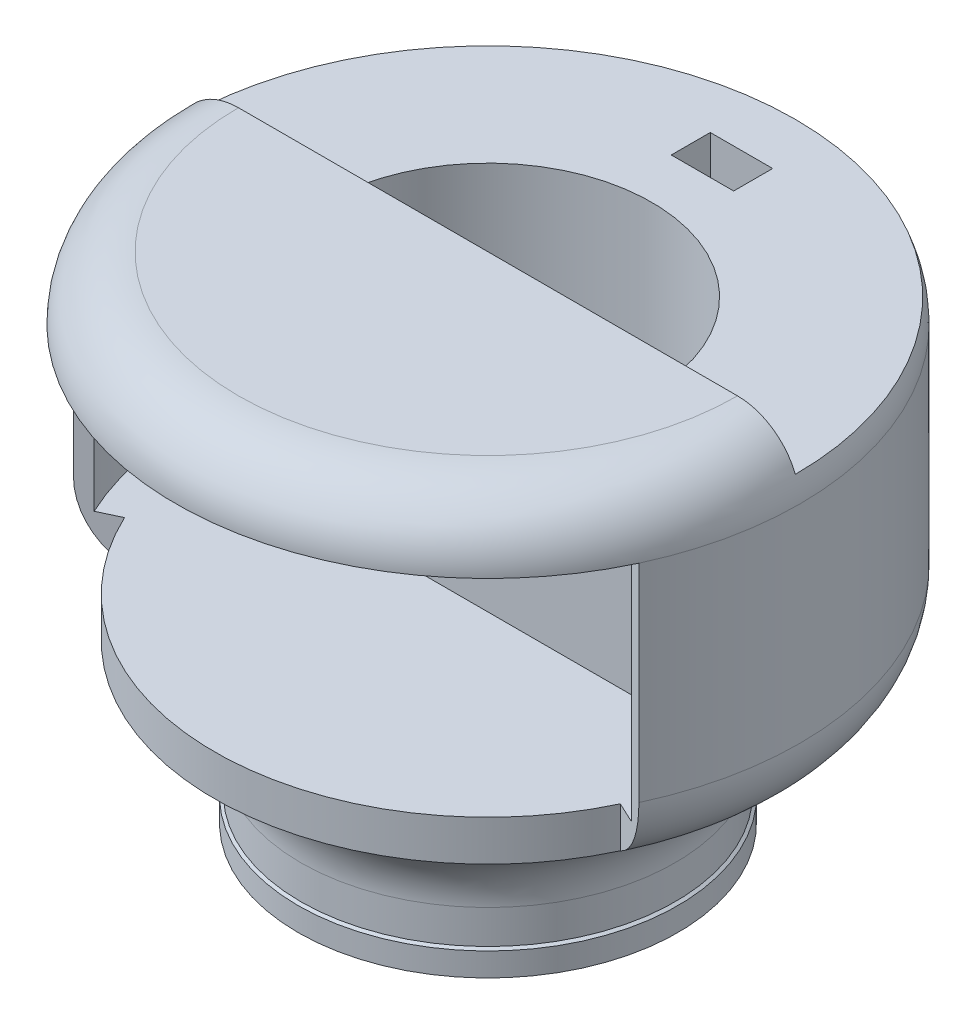
from build123d import *

# Parameters (mm, degrees)
CUT_EXTRUDE3_DEPTH           = 60
CUT_EXTRUDE5_DEPTH           = 2
CUT_EXTRUDE5_DEPTH_BACK      = 30
SKETCH9_R                    = 38
SKETCH9_R_2                  = 23
SKETCH19_W                   = 12
SKETCH19_H                   = 36.5
CUT_REVOLVE2_ANGLE           = 65
CUT_REVOLVE2_OTHER_WAY_ANGLE = 65
SKETCH21_W                   = 3.25
SKETCH21_H                   = 4
BOSS_EXTRUDE3_DEPTH          = 1.35
CIRPATTERN1_COUNT            = 5
CUT_EXTRUDE9_START           = -5
CUT_EXTRUDE9_DEPTH           = 5
SKETCH23_R                   = 10.5
CUT_EXTRUDE10_DEPTH          = 10
SKETCH24_W                   = 15
SKETCH24_H                   = 8
BOSS_EXTRUDE4_DEPTH          = 8
SKETCH26_W                   = 8
SKETCH26_H                   = 5
CUT_EXTRUDE11_DEPTH          = 10
SKETCH27_W                   = 4
SKETCH27_H                   = 5
CUT_EXTRUDE12_DEPTH          = 5
CUT_EXTRUDE14_DEPTH          = 2
CUT_EXTRUDE14_DEPTH_BACK     = 30


with BuildPart() as part:
    # Sketch1 → Revolve1 (revolve)
    with BuildSketch(Plane.XY):
        with BuildLine():
            Line((0, 63.427876097), (32, 63.427876097))
            ThreePointArc((32, 63.427876097), (37.656854249, 61.084730346), (40, 55.427876097))
            Line((40, 55.427876097), (40, 28.846818009))
            ThreePointArc((40, 28.846818009), (38.792081772, 24.082439968), (35.460140376, 20.469057744))
            Line((35.460140376, 20.469057744), (28.539859624, 15.958818353))
            ThreePointArc((28.539859624, 15.958818353), (25.207918228, 12.345436129), (24, 7.581058088))
            Line((24, 7.581058088), (24, 3.25))
            Line((24, 3.25), (24.35, 3))
            Line((24.35, 3), (24.35, 0))
            Line((24.35, 0), (22.5, 0))
            Line((22.5, 0), (22.5, 12.5))
            ThreePointArc((22.5, 12.5), (22.353553391, 12.853553391), (22, 13))
            Line((22, 13), (0, 13))
            Line((0, 13), (0, 63.427876097))
        make_face()
    revolve(axis=Axis((0, 0, 0), (0, 1, 0)))

    # Sketch11 → Cut-Extrude3 (cut)
    with BuildSketch(Plane(origin=(0, 13, 0), x_dir=(-1, 0, 0), z_dir=(0, -1, 0))):
        with BuildLine():
            Line((-21, 0), (21, 0))
            ThreePointArc((21, 0), (0, 21), (-21, 0))
        make_face()
    extrude(amount=-CUT_EXTRUDE3_DEPTH, mode=Mode.SUBTRACT)

    # Sketch9 → Cut-Extrude5 (cut, two sides: drawn at the far end of the back side and taken through both)
    with BuildSketch(Plane(origin=(0, 55.427876097, 0), x_dir=(1, 0, 0), z_dir=(0, 1, 0)).offset(-CUT_EXTRUDE5_DEPTH_BACK)):
        Circle(SKETCH9_R)
        Circle(SKETCH9_R_2, mode=Mode.SUBTRACT)
    extrude(amount=CUT_EXTRUDE5_DEPTH + CUT_EXTRUDE5_DEPTH_BACK, mode=Mode.SUBTRACT)

    # Sketch19 → Cut-Revolve2 (revolve, cut)
    with BuildSketch(Plane(origin=(0, 0, 0), x_dir=(0, 0, -1), z_dir=(1, 0, 0))):
        with Locations((-41.064715832, 37.177876097)):
            Rectangle(SKETCH19_W, SKETCH19_H)
    revolve(axis=Axis((0, 0, 0), (0, 1, 0)), revolution_arc=CUT_REVOLVE2_ANGLE, mode=Mode.SUBTRACT)

    # Sketch19 → Cut-Revolve2 other way (revolve, cut)
    with BuildSketch(Plane(origin=(0, 0, 0), x_dir=(0, 0, -1), z_dir=(1, 0, 0))):
        with Locations((-41.064715832, 37.177876097)):
            Rectangle(SKETCH19_W, SKETCH19_H)
    revolve(axis=Axis((0, 0, 0), (0, -1, 0)), revolution_arc=CUT_REVOLVE2_OTHER_WAY_ANGLE, mode=Mode.SUBTRACT)

    # Sketch21 → Boss-Extrude3 (add)
    with BuildSketch(Plane(origin=(0, 0, 22.5), x_dir=(-1, 0, 0), z_dir=(0, 0, -1))):
        with Locations((0, 2)):
            Rectangle(SKETCH21_W, SKETCH21_H)
    boss_extrude3 = extrude(amount=BOSS_EXTRUDE3_DEPTH)

    # CirPattern1: Boss-Extrude3 ×5 about axis
    cirpattern1_axis = Axis((0, 0, 0), (0, -1, 0))
    for i in range(1, CIRPATTERN1_COUNT):
        add(boss_extrude3.rotate(cirpattern1_axis, i * 360 / CIRPATTERN1_COUNT))

    # Sketch22 → Cut-Extrude9 (cut)
    with BuildSketch(Plane(origin=(0, 63.427876097, 0), x_dir=(1, 0, 0), z_dir=(0, 1, 0)).offset(CUT_EXTRUDE9_START)):
        with BuildLine():
            Line((-40, 0), (40, 0))
            ThreePointArc((40, 0), (0, 40), (-40, 0))
        make_face()
    extrude(amount=CUT_EXTRUDE9_DEPTH, mode=Mode.SUBTRACT)

    # Sketch23 → Cut-Extrude10 (cut)
    with BuildSketch(Plane(origin=(0, 0, -40), x_dir=(-1, 0, 0), z_dir=(0, 0, -1))):
        with Locations((0, 42.137876097)):
            Circle(SKETCH23_R)
    extrude(amount=-CUT_EXTRUDE10_DEPTH, mode=Mode.SUBTRACT)

    # Sketch24 → Boss-Extrude4 (add)
    with BuildSketch(Plane(origin=(0, 58.427876097, 0), x_dir=(1, 0, 0), z_dir=(0, 1, 0))):
        with Locations((0, 30)):
            Rectangle(SKETCH24_W, SKETCH24_H)
    extrude(amount=-BOSS_EXTRUDE4_DEPTH)

    # Sketch26 → Cut-Extrude11 (cut)
    with BuildSketch(Plane(origin=(0, 58.427876097, 0), x_dir=(1, 0, 0), z_dir=(0, 1, 0))):
        with Locations((0, 30)):
            Rectangle(SKETCH26_W, SKETCH26_H)
    extrude(amount=-CUT_EXTRUDE11_DEPTH, mode=Mode.SUBTRACT)

    # Sketch27 → Cut-Extrude12 (cut)
    with BuildSketch(Plane(origin=(7.5, 0, 0), x_dir=(0, 0, -1), z_dir=(1, 0, 0))):
        with Locations((30, 53.927876097)):
            Rectangle(SKETCH27_W, SKETCH27_H)
    extrude(amount=-CUT_EXTRUDE12_DEPTH, mode=Mode.SUBTRACT)

    # Sketch28 → Cut-Extrude14 (cut, two sides: drawn at the far end of the back side and taken through both)
    with BuildSketch(Plane(origin=(0, 55.427876097, 0), x_dir=(1, 0, 0), z_dir=(0, 1, 0)).offset(-CUT_EXTRUDE14_DEPTH_BACK)):
        with BuildLine():
            Line((-22.912878475, -2), (22.912878475, -2))
            ThreePointArc((22.912878475, -2), (0, -23), (-22.912878475, -2))
        make_face()
    extrude(amount=CUT_EXTRUDE14_DEPTH + CUT_EXTRUDE14_DEPTH_BACK, mode=Mode.SUBTRACT)


solid = part.part
